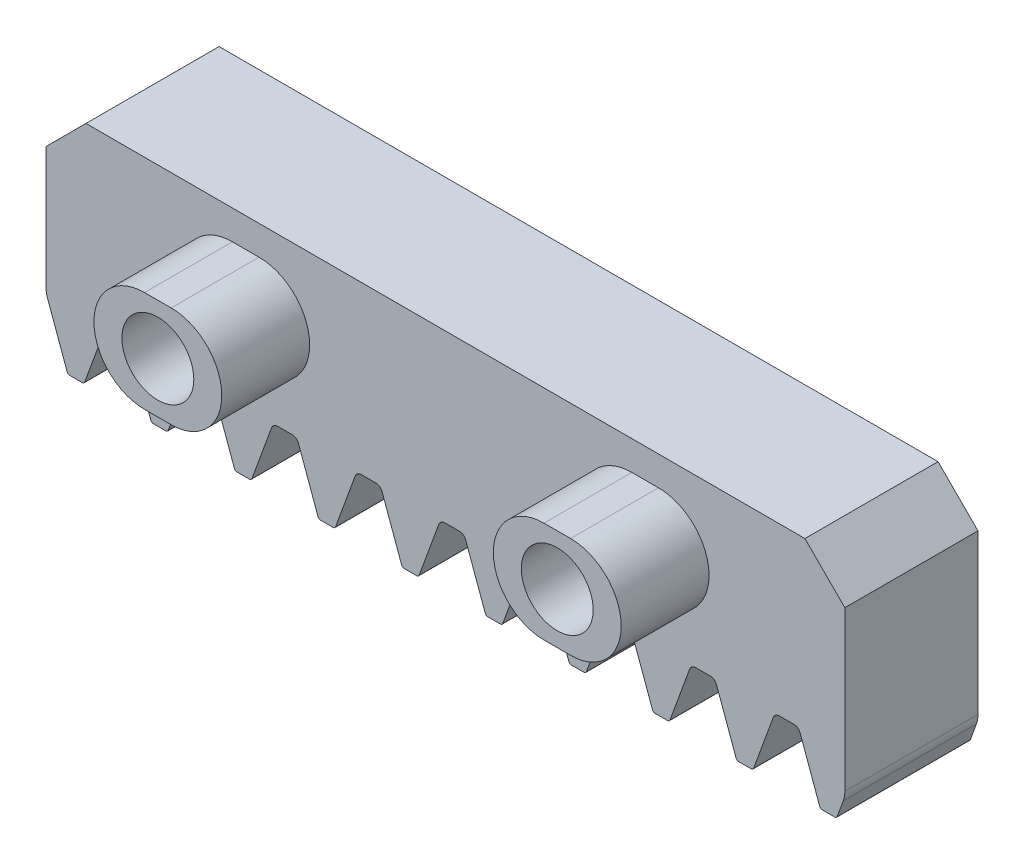
from build123d import *

# Parameters (mm, degrees)
SZKIC1_W                    = 30
SZKIC1_H                    = 8.5
DODANIE_WYCI_GNI_CIE1_DEPTH = 2.5
WYTNIJ_WYCI_GNI_CIE1_DEPTH  = 16.789632675
ZAOKR_GLENIE1_R             = 0.25
ZAOKR_GLENIE2_R             = 0.1
SZYK_START                  = -2.5
SZYK_LINIOWY1_DEPTH         = 5
ZAOKR_GLENIE3_R             = 1
DODANIE_WYCI_GNI_CIE2_DEPTH = 3.3
SZKIC4_R                    = 1.35
WYTNIJ_WYCI_GNI_CIE2_DEPTH  = 7.5
SFAZOWANIE1_SIZE            = 1.5


# Read off the part's stored shape, not the designer's step: Szyk liniowy1
with BuildPart() as part:
    # Szkic1 → Dodanie-wyciągnięcie1 (new, symmetric)
    with BuildSketch(Plane.XY):
        Rectangle(SZKIC1_W, SZKIC1_H)
    extrude(amount=DODANIE_WYCI_GNI_CIE1_DEPTH, both=True)

    # Szkic2 → Wytnij-wyciągnięcie1 (cut, symmetric)
    with BuildSketch(Plane.XY):
        Polygon((-13.57, -4.25), (-12.75, -2), (-11.86, -2), (-11.04, -4.25), align=None)
    extrude(amount=WYTNIJ_WYCI_GNI_CIE1_DEPTH, both=True, mode=Mode.SUBTRACT)

    # Zaokrąglenie1
    zaokr_glenie1_edges = [part.edges().sort_by_distance(p)[0] for p in [
        (-12.75, -2, 0),
        (-11.86, -2, 0),
    ]]
    fillet(zaokr_glenie1_edges, radius=ZAOKR_GLENIE1_R)

    # Zaokrąglenie2
    zaokr_glenie2_edges = [part.edges().sort_by_distance(p)[0] for p in [
        (-11.04, -4.25, 0),
        (-13.57, -4.25, 0),
    ]]
    fillet(zaokr_glenie2_edges, radius=ZAOKR_GLENIE2_R)

    # Szyk liniowy1 outline → Szyk liniowy1 (cut)
    with BuildSketch(Plane.XY.offset(SZYK_START)):
        with BuildLine():
            ThreePointArc((-8.660086567, -2.164396615), (-8.751622667, -2.045181975), (-8.894973903, -2))
            Line((-8.894973903, -2), (-9.435026097, -2))
            ThreePointArc((-9.435026097, -2), (-9.578377333, -2.045181975), (-9.669913433, -2.164396615))
            Line((-9.669913433, -2.164396615), (-10.406034627, -4.184241354))
            ThreePointArc((-10.406034627, -4.184241354), (-10.442649067, -4.23192721), (-10.499989561, -4.25))
            Line((-10.499989561, -4.25), (-7.830010439, -4.25))
            ThreePointArc((-7.830010439, -4.25), (-7.887350933, -4.23192721), (-7.923965373, -4.184241354))
            Line((-7.923965373, -4.184241354), (-8.660086567, -2.164396615))
        make_face()
        with BuildLine():
            ThreePointArc((14.713965373, -4.184241354), (14.677350933, -4.23192721), (14.620010439, -4.25))
            Line((14.620010439, -4.25), (15, -4.25))
            Line((15, -4.25), (15, -3.399390244))
            Line((15, -3.399390244), (14.713965373, -4.184241354))
        make_face()
        with BuildLine():
            ThreePointArc((11.573965373, -4.184241354), (11.537350933, -4.23192721), (11.480010439, -4.25))
            Line((11.480010439, -4.25), (14.149989561, -4.25))
            ThreePointArc((14.149989561, -4.25), (14.092649067, -4.23192721), (14.056034627, -4.184241354))
            Line((14.056034627, -4.184241354), (13.319913433, -2.164396615))
            ThreePointArc((13.319913433, -2.164396615), (13.228377333, -2.045181975), (13.085026097, -2))
            Line((13.085026097, -2), (12.544973903, -2))
            ThreePointArc((12.544973903, -2), (12.401622667, -2.045181975), (12.310086567, -2.164396615))
            Line((12.310086567, -2.164396615), (11.573965373, -4.184241354))
        make_face()
        with BuildLine():
            ThreePointArc((8.433965373, -4.184241354), (8.397350933, -4.23192721), (8.340010439, -4.25))
            Line((8.340010439, -4.25), (11.009989561, -4.25))
            ThreePointArc((11.009989561, -4.25), (10.952649067, -4.23192721), (10.916034627, -4.184241354))
            Line((10.916034627, -4.184241354), (10.179913433, -2.164396615))
            ThreePointArc((10.179913433, -2.164396615), (10.088377333, -2.045181975), (9.945026097, -2))
            Line((9.945026097, -2), (9.404973903, -2))
            ThreePointArc((9.404973903, -2), (9.261622667, -2.045181975), (9.170086567, -2.164396615))
            Line((9.170086567, -2.164396615), (8.433965373, -4.184241354))
        make_face()
        with BuildLine():
            ThreePointArc((5.293965373, -4.184241354), (5.257350933, -4.23192721), (5.200010439, -4.25))
            Line((5.200010439, -4.25), (7.869989561, -4.25))
            ThreePointArc((7.869989561, -4.25), (7.812649067, -4.23192721), (7.776034627, -4.184241354))
            Line((7.776034627, -4.184241354), (7.039913433, -2.164396615))
            ThreePointArc((7.039913433, -2.164396615), (6.948377333, -2.045181975), (6.805026097, -2))
            Line((6.805026097, -2), (6.264973903, -2))
            ThreePointArc((6.264973903, -2), (6.121622667, -2.045181975), (6.030086567, -2.164396615))
            Line((6.030086567, -2.164396615), (5.293965373, -4.184241354))
        make_face()
        with BuildLine():
            ThreePointArc((2.153965373, -4.184241354), (2.117350933, -4.23192721), (2.060010439, -4.25))
            Line((2.060010439, -4.25), (4.729989561, -4.25))
            ThreePointArc((4.729989561, -4.25), (4.672649067, -4.23192721), (4.636034627, -4.184241354))
            Line((4.636034627, -4.184241354), (3.899913433, -2.164396615))
            ThreePointArc((3.899913433, -2.164396615), (3.808377333, -2.045181975), (3.665026097, -2))
            Line((3.665026097, -2), (3.124973903, -2))
            ThreePointArc((3.124973903, -2), (2.981622667, -2.045181975), (2.890086567, -2.164396615))
            Line((2.890086567, -2.164396615), (2.153965373, -4.184241354))
        make_face()
        with BuildLine():
            ThreePointArc((-0.986034627, -4.184241354), (-1.022649067, -4.23192721), (-1.079989561, -4.25))
            Line((-1.079989561, -4.25), (1.589989561, -4.25))
            ThreePointArc((1.589989561, -4.25), (1.532649067, -4.23192721), (1.496034627, -4.184241354))
            Line((1.496034627, -4.184241354), (0.759913433, -2.164396615))
            ThreePointArc((0.759913433, -2.164396615), (0.668377333, -2.045181975), (0.525026097, -2))
            Line((0.525026097, -2), (-0.015026097, -2))
            ThreePointArc((-0.015026097, -2), (-0.158377333, -2.045181975), (-0.249913433, -2.164396615))
            Line((-0.249913433, -2.164396615), (-0.986034627, -4.184241354))
        make_face()
        with BuildLine():
            ThreePointArc((-4.126034627, -4.184241354), (-4.162649067, -4.23192721), (-4.219989561, -4.25))
            Line((-4.219989561, -4.25), (-1.550010439, -4.25))
            ThreePointArc((-1.550010439, -4.25), (-1.607350933, -4.23192721), (-1.643965373, -4.184241354))
            Line((-1.643965373, -4.184241354), (-2.380086567, -2.164396615))
            ThreePointArc((-2.380086567, -2.164396615), (-2.471622667, -2.045181975), (-2.614973903, -2))
            Line((-2.614973903, -2), (-3.155026097, -2))
            ThreePointArc((-3.155026097, -2), (-3.298377333, -2.045181975), (-3.389913433, -2.164396615))
            Line((-3.389913433, -2.164396615), (-4.126034627, -4.184241354))
        make_face()
        with BuildLine():
            ThreePointArc((-7.266034627, -4.184241354), (-7.302649067, -4.23192721), (-7.359989561, -4.25))
            Line((-7.359989561, -4.25), (-4.690010439, -4.25))
            ThreePointArc((-4.690010439, -4.25), (-4.747350933, -4.23192721), (-4.783965373, -4.184241354))
            Line((-4.783965373, -4.184241354), (-5.520086567, -2.164396615))
            ThreePointArc((-5.520086567, -2.164396615), (-5.611622667, -2.045181975), (-5.754973903, -2))
            Line((-5.754973903, -2), (-6.295026097, -2))
            ThreePointArc((-6.295026097, -2), (-6.438377333, -2.045181975), (-6.529913433, -2.164396615))
            Line((-6.529913433, -2.164396615), (-7.266034627, -4.184241354))
        make_face()
        with BuildLine():
            Line((-15, -4.25), (-14.110010439, -4.25))
            ThreePointArc((-14.110010439, -4.25), (-14.167350933, -4.23192721), (-14.203965373, -4.184241354))
            Line((-14.203965373, -4.184241354), (-14.940086567, -2.164396615))
            ThreePointArc((-14.940086567, -2.164396615), (-14.964838585, -2.11456312), (-15, -2.071438713))
            Line((-15, -2.071438713), (-15, -4.25))
        make_face()
    extrude(amount=SZYK_LINIOWY1_DEPTH, mode=Mode.SUBTRACT)

    # Zaokrąglenie3
    zaokr_glenie3_edges = [part.edges().sort_by_distance(p)[0] for p in [
        (-15, -2.071438713, 0),
        (15, -3.399390244, 0),
    ]]
    fillet(zaokr_glenie3_edges, radius=ZAOKR_GLENIE3_R)

    # Szkic3 → Dodanie-wyciągnięcie2 (add)
    with BuildSketch(Plane.XY.offset(2.5)):
        with BuildLine():
            Line((-8, 3.15), (-7, 3.15))
            ThreePointArc((-7, 3.15), (-5.1, 1.25), (-7, -0.65))
            Line((-7, -0.65), (-8, -0.65))
            ThreePointArc((-8, -0.65), (-9.9, 1.25), (-8, 3.15))
        make_face()
    dodanie_wyci_gni_cie2 = extrude(amount=DODANIE_WYCI_GNI_CIE2_DEPTH)

    # Szkic4 → Wytnij-wyciągnięcie2 (cut)
    with BuildSketch(Plane.XY.offset(5.8)):
        with Locations((-7.5, 1.25)):
            Circle(SZKIC4_R)
    wytnij_wyci_gni_cie2 = extrude(amount=-WYTNIJ_WYCI_GNI_CIE2_DEPTH, mode=Mode.SUBTRACT)

    # Lustro1: Dodanie-wyciągnięcie2, Wytnij-wyciągnięcie2 across plane
    add(dodanie_wyci_gni_cie2.mirror(Plane(origin=(0, 0, 0), x_dir=(0, 0, 1), z_dir=(1, 0, 0))))
    add(wytnij_wyci_gni_cie2.mirror(Plane(origin=(0, 0, 0), x_dir=(0, 0, 1), z_dir=(1, 0, 0))), mode=Mode.SUBTRACT)

    # Sfazowanie1
    sfazowanie1_edges = [part.edges().sort_by_distance(p)[0] for p in [
        (-15, 4.25, 0),
        (15, 4.25, 0),
    ]]
    chamfer(sfazowanie1_edges, length=SFAZOWANIE1_SIZE)


solid = part.part
